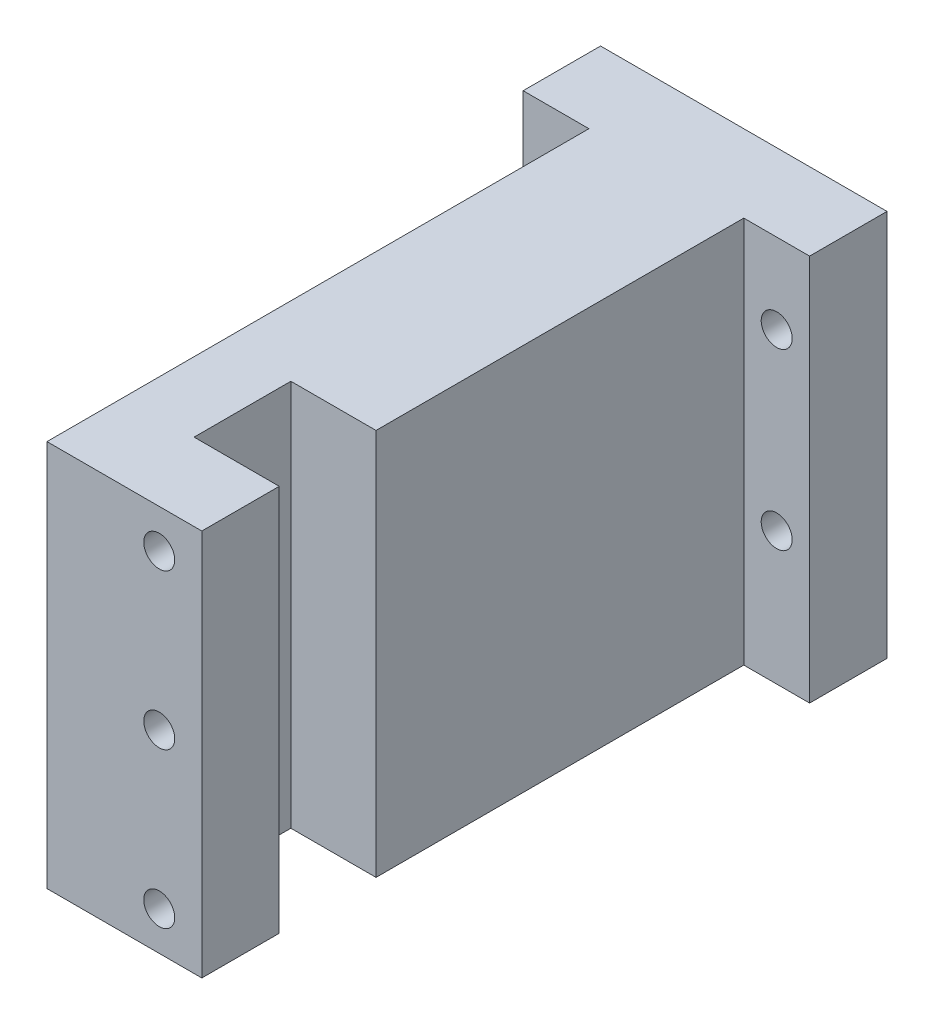
from build123d import *

# Parameters (mm, degrees)
SZKIC1_W                    = 74
SZKIC1_H                    = 100
DODANIE_WYCI_GNI_CIE1_DEPTH = 20
SZKIC3_W                    = 40
SZKIC3_H                    = 100
DODANIE_WYCI_GNI_CIE2_DEPTH = 140
SZKIC4_R                    = 4
WYTNIJ_WYCI_GNI_CIE1_DEPTH  = 20
SZYK_LINIOWY1_COUNT         = 2
SZYK_LINIOWY1_PITCH         = 45
SZYK_LINIOWY1_COUNT_DIR2    = 2
SZYK_LINIOWY1_PITCH_DIR2    = 57
SZKIC5_W                    = 22
SZKIC5_H                    = 25
WYTNIJ_WYCI_GNI_CIE2_DEPTH  = 100
SZKIC6_R                    = 4
WYTNIJ_WYCI_GNI_CIE3_DEPTH  = 10


with BuildPart() as part:
    # Szkic1 → Dodanie-wyciągnięcie1 (new body)
    with BuildSketch(Plane.XY):
        with Locations((-0.134142184, -43.811615453)):
            Rectangle(SZKIC1_W, SZKIC1_H)
    extrude(amount=DODANIE_WYCI_GNI_CIE1_DEPTH)

    # Szkic3 → Dodanie-wyciągnięcie2 (add)
    with BuildSketch(Plane.XY.offset(20)):
        with Locations((-0.134142184, -43.811615453)):
            Rectangle(SZKIC3_W, SZKIC3_H)
    extrude(amount=DODANIE_WYCI_GNI_CIE2_DEPTH)

    # Szkic4 → Wytnij-wyciągnięcie1 (cut)
    with BuildSketch(Plane.XY.offset(20)):
        with Locations((-28.634142184, -14.511615453)):
            Circle(SZKIC4_R)
    wytnij_wyci_gni_cie1 = extrude(amount=-WYTNIJ_WYCI_GNI_CIE1_DEPTH, mode=Mode.SUBTRACT)

    # Szyk liniowy1: Wytnij-wyci_gni_cie1 2 × 2
    with Locations(*[(j * SZYK_LINIOWY1_PITCH_DIR2, -i * SZYK_LINIOWY1_PITCH, 0) for i in range(SZYK_LINIOWY1_COUNT) for j in range(SZYK_LINIOWY1_COUNT_DIR2) if (i, j) != (0, 0)]):
        add(wytnij_wyci_gni_cie1, mode=Mode.SUBTRACT)

    # Szkic5 → Wytnij-wyciągnięcie2 (cut)
    with BuildSketch(Plane(origin=(0, 6.188384547, 0), x_dir=(1, 0, 0), z_dir=(0, 1, 0))):
        with Locations((8.865857816, -127.5)):
            Rectangle(SZKIC5_W, SZKIC5_H)
    extrude(amount=-WYTNIJ_WYCI_GNI_CIE2_DEPTH, mode=Mode.SUBTRACT)

    # Szkic6 → Wytnij-wyciągnięcie3 (cut)
    with BuildSketch(Plane.XY.offset(160)):
        with Locations((8.865857816, -3.811615453)):
            Circle(SZKIC6_R)
        with Locations((8.865857816, -43.811615453)):
            Circle(SZKIC6_R)
        with Locations((8.865857816, -83.811615453)):
            Circle(SZKIC6_R)
    extrude(amount=-WYTNIJ_WYCI_GNI_CIE3_DEPTH, mode=Mode.SUBTRACT)


solid = part.part
